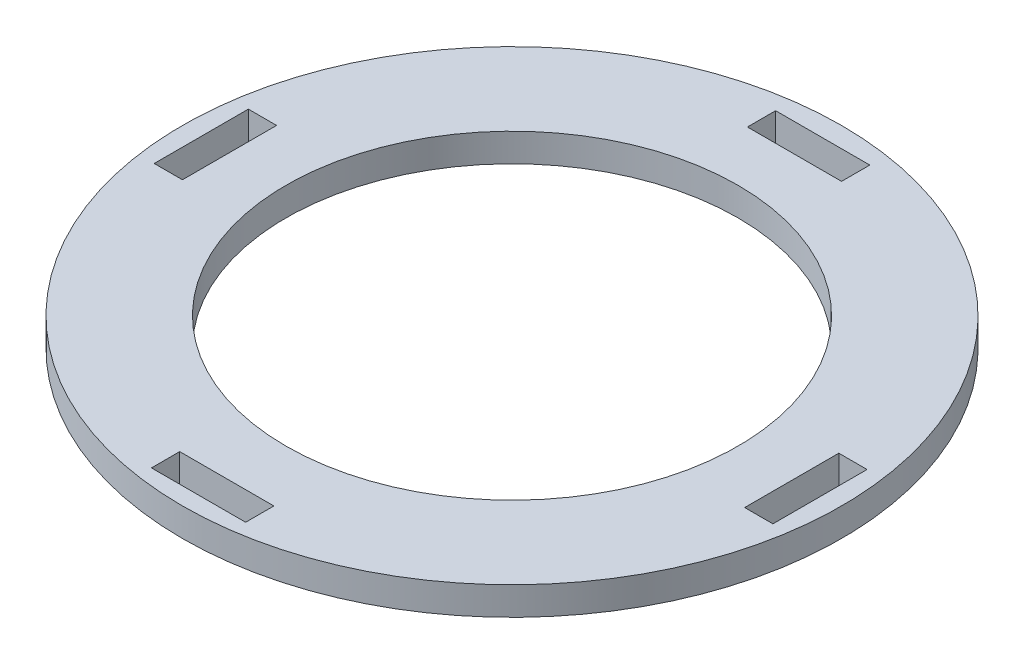
from build123d import *

# Parameters (mm, degrees)
SKICA1_R                 = 35
P_IDAT_VYSUNUT_M1_DEPTH  = 3
SKICA2_R                 = 24
ODEBRAT_VYSUNUT_M1_DEPTH = 3
SKICA3_W                 = 10
SKICA3_H                 = 3
SKICA3_W_2               = 3
SKICA3_H_2               = 10
ODEBRAT_VYSUNUT_M3_DEPTH = 3


with BuildPart() as part:
    # Skica1 → Přidat vysunutím1 (new body)
    with BuildSketch(Plane(origin=(0, 0, 0), x_dir=(1, 0, 0), z_dir=(0, 1, 0))):
        Circle(SKICA1_R)
    extrude(amount=P_IDAT_VYSUNUT_M1_DEPTH)

    # Skica2 → Odebrat vysunutím1 (cut)
    with BuildSketch(Plane(origin=(0, 3, 0), x_dir=(1, 0, 0), z_dir=(0, 1, 0))):
        Circle(SKICA2_R)
    extrude(amount=-ODEBRAT_VYSUNUT_M1_DEPTH, mode=Mode.SUBTRACT)

    # Skica3 → Odebrat vysunutím3 (cut)
    with BuildSketch(Plane(origin=(0, 3, 0), x_dir=(1, 0, 0), z_dir=(0, 1, 0))):
        with Locations((0.14520747, 31.35479253)):
            Rectangle(SKICA3_W, SKICA3_H)
        with Locations((-31.5, 0)):
            Rectangle(SKICA3_W_2, SKICA3_H_2)
        with Locations((31.5, -0.290414941)):
            Rectangle(SKICA3_W_2, SKICA3_H_2)
        with Locations((-0.14520747, -31.64520747)):
            Rectangle(SKICA3_W, SKICA3_H)
    extrude(amount=-ODEBRAT_VYSUNUT_M3_DEPTH, mode=Mode.SUBTRACT)


solid = part.part
